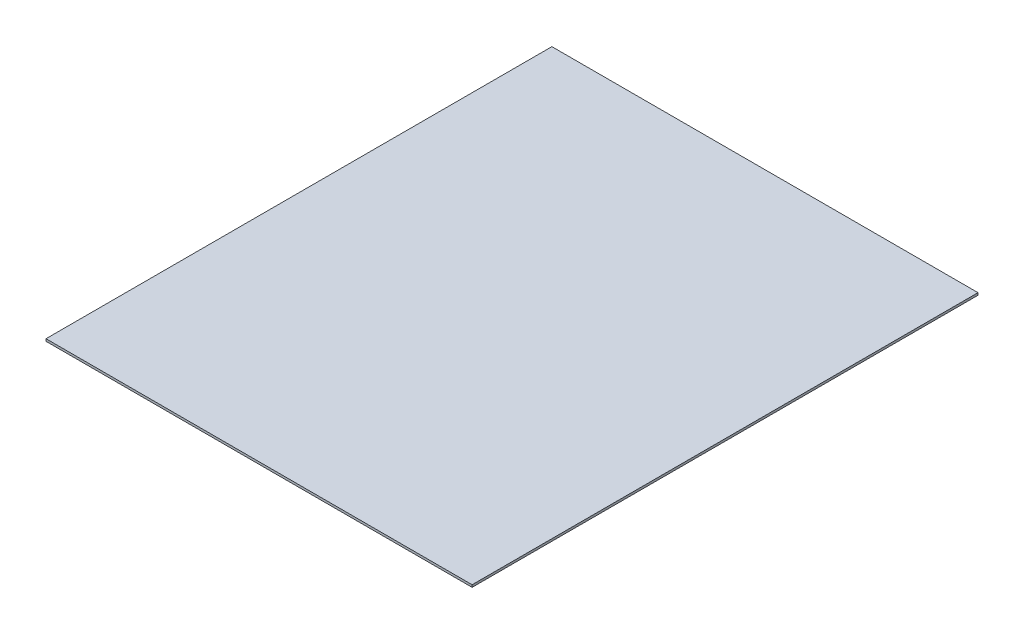
from build123d import *

# Parameters (mm, degrees)
SKETCH1_W           = 187
SKETCH1_H           = 222
BOSS_EXTRUDE1_DEPTH = 1


with BuildPart() as part:
    # Sketch1 → Boss-Extrude1 (new body)
    with BuildSketch(Plane(origin=(0, 0, 0), x_dir=(1, 0, 0), z_dir=(0, 1, 0))):
        with Locations((37.397058758, 75.462578399)):
            Rectangle(SKETCH1_W, SKETCH1_H)
    extrude(amount=BOSS_EXTRUDE1_DEPTH)


solid = part.part
